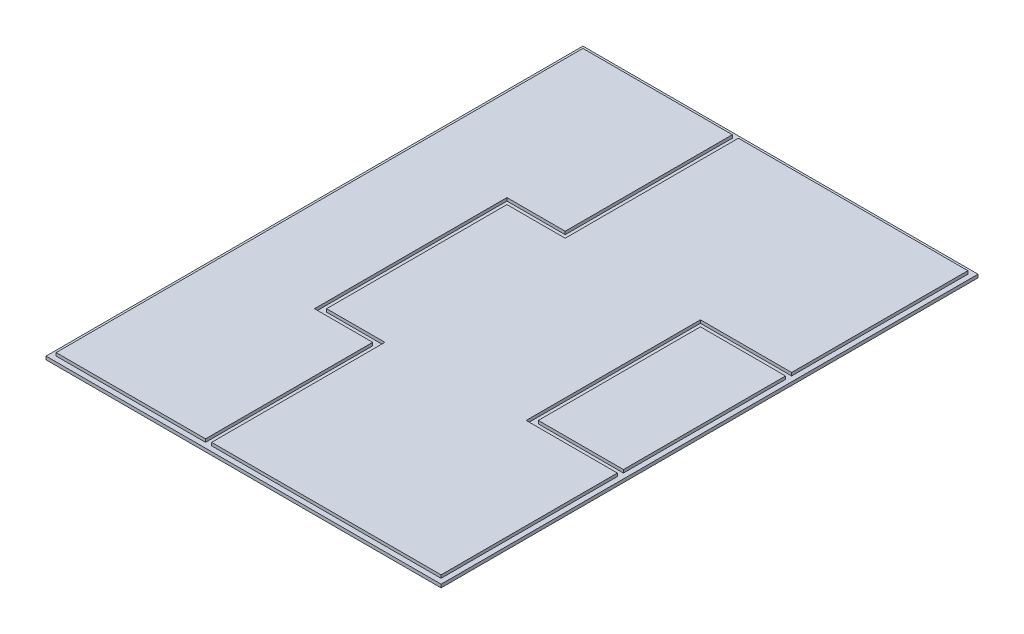
from build123d import *

# Parameters (mm, degrees)
SKETCH1_W           = 39
SKETCH1_H           = 53
BOSS_EXTRUDE1_DEPTH = 0.32
SKETCH2_W           = 8.4
SKETCH2_H           = 16
BOSS_EXTRUDE2_DEPTH = 0.3
SKETCH5_W           = 38
SKETCH5_H           = 52
BOSS_EXTRUDE3_DEPTH = 0.3


with BuildPart() as part:
    # Sketch1 → Boss-Extrude1 (new body)
    with BuildSketch(Plane(origin=(0, 0, 0), x_dir=(1, 0, 0), z_dir=(0, 1, 0))):
        with Locations((5.755506608, 7.085903084)):
            Rectangle(SKETCH1_W, SKETCH1_H)
    extrude(amount=BOSS_EXTRUDE1_DEPTH)

    # Sketch2 → Boss-Extrude2 (add)
    with BuildSketch(Plane(origin=(0, 0.32, 0), x_dir=(1, 0, 0), z_dir=(0, 1, 0))):
        Polygon((-13.244493392, 33.085903084), (-13.244493392, -18.914096916), (1.505506608, -18.914096916), (1.505506608, -2.414096916), (-4.244493392, -2.414096916), (-4.244493392, 16.585903084), (1.505506608, 16.585903084), (1.505506608, 33.085903084), align=None)
        Polygon((2.105506608, 33.085903084), (24.755506608, 33.085903084), (24.755506608, 15.685903084), (15.755506608, 15.685903084), (15.755506608, -1.514096916), (24.755506608, -1.514096916), (24.755506608, -18.914096916), (2.105506608, -18.914096916), (2.105506608, -1.814096916), (-3.644493392, -1.814096916), (-3.644493392, 15.985903084), (2.105506608, 15.985903084), align=None)
        with Locations((20.555506608, 7.085903084)):
            Rectangle(SKETCH2_W, SKETCH2_H)
    extrude(amount=BOSS_EXTRUDE2_DEPTH)


with BuildPart() as body_2:
    # Split1: the piece on the far side of the plane
    add(part.part)
    split(bisect_by=Plane.ZX.offset(0.32), keep=Keep.BOTTOM)

    # Sketch5 → Boss-Extrude3 (add)
    with BuildSketch(Plane.XZ):
        with Locations((5.755506608, -7.085903084)):
            Rectangle(SKETCH5_W, SKETCH5_H)
    extrude(amount=BOSS_EXTRUDE3_DEPTH)


with BuildPart() as part_1:
    add(part.part)

    # Split1
    split(bisect_by=Plane.ZX.offset(0.32), keep=Keep.TOP)


with BuildPart() as body_3:
    # Split2: the piece on the far side of the plane
    add(body_2.part)
    split(bisect_by=Plane.ZX, keep=Keep.BOTTOM)


with BuildPart() as body_2_1:
    add(body_2.part)

    # Split2
    split(bisect_by=Plane.ZX, keep=Keep.TOP)


solid = Compound([part_1.part, body_3.part, body_2_1.part])
